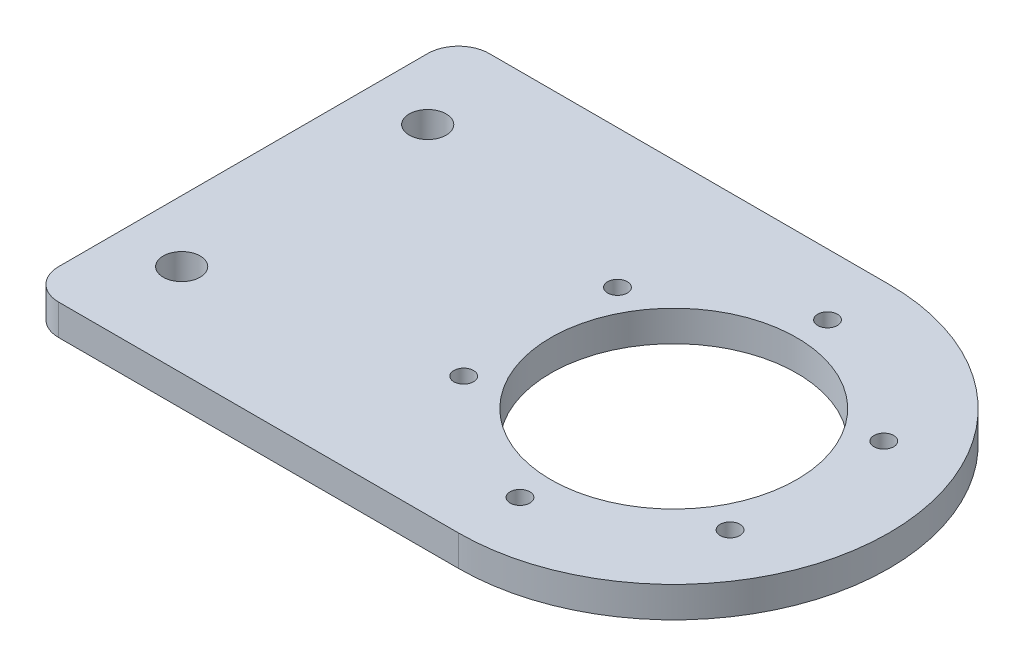
from build123d import *

# Parameters (mm, degrees)
SKETCH1_R           = 1.6
SKETCH1_R_2         = 20
SKETCH1_R_3         = 3
BOSS_EXTRUDE1_DEPTH = 5
FILLET1_R           = 5
SKETCH4_R           = 3.25
CUT_EXTRUDE2_DEPTH  = 1.5


with BuildPart() as part:
    # Sketch1 → Boss-Extrude1 (new body)
    with BuildSketch(Plane(origin=(0, 0, 0), x_dir=(1, 0, 0), z_dir=(0, 1, 0))):
        with BuildLine():
            Line((-70, 35), (0, 35))
            ThreePointArc((0, 35), (35, 0), (0, -35))
            Line((0, -35), (-70, -35))
            Line((-70, -35), (-70, 35))
        make_face()
        with Locations((0, 25)):
            Circle(SKETCH1_R, mode=Mode.SUBTRACT)
        with Locations((21.650635095, 12.5)):
            Circle(SKETCH1_R, mode=Mode.SUBTRACT)
        with Locations((21.650635095, -12.5)):
            Circle(SKETCH1_R, mode=Mode.SUBTRACT)
        with Locations((0, -25)):
            Circle(SKETCH1_R, mode=Mode.SUBTRACT)
        with Locations((-21.650635095, -12.5)):
            Circle(SKETCH1_R, mode=Mode.SUBTRACT)
        with Locations((-21.650635095, 12.5)):
            Circle(SKETCH1_R, mode=Mode.SUBTRACT)
        Circle(SKETCH1_R_2, mode=Mode.SUBTRACT)
        with Locations((-60, 20)):
            Circle(SKETCH1_R_3, mode=Mode.SUBTRACT)
        with Locations((-60, -20)):
            Circle(SKETCH1_R_3, mode=Mode.SUBTRACT)
    extrude(amount=BOSS_EXTRUDE1_DEPTH)

    # Fillet1
    fillet1_edges = [part.edges().sort_by_distance(p)[0] for p in [
        (-70, 2.5, -35),
        (-70, 2.5, 35),
    ]]
    fillet(fillet1_edges, radius=FILLET1_R)

    # Sketch4 → Cut-Extrude2 (cut)
    with BuildSketch(Plane.XZ):
        with Locations((0, 25)):
            Circle(SKETCH4_R)
        with Locations((21.650635095, 12.5)):
            Circle(SKETCH4_R)
        with Locations((21.650635095, -12.5)):
            Circle(SKETCH4_R)
        with Locations((0, -25)):
            Circle(SKETCH4_R)
        with Locations((-21.650635095, -12.5)):
            Circle(SKETCH4_R)
        with Locations((-21.650635095, 12.5)):
            Circle(SKETCH4_R)
    extrude(amount=-CUT_EXTRUDE2_DEPTH, mode=Mode.SUBTRACT)


solid = part.part
